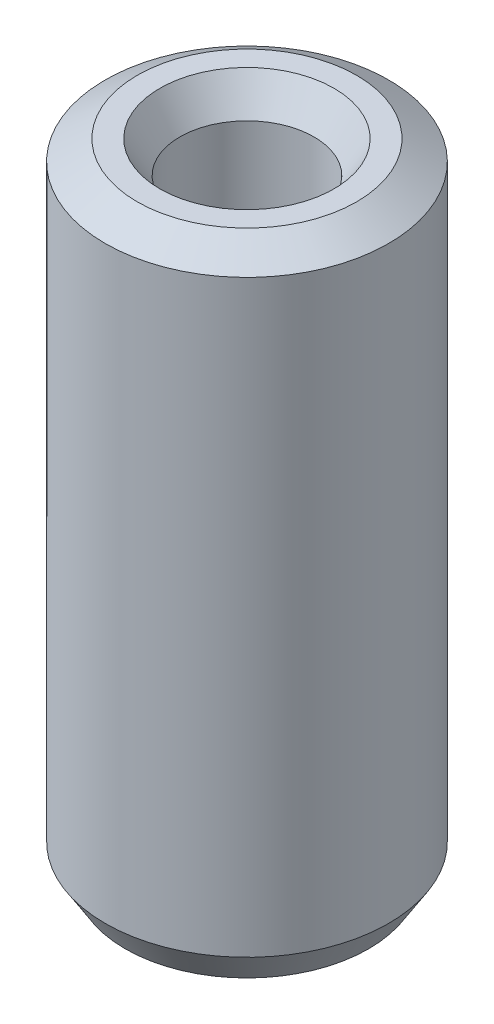
from build123d import *
from OCP.BRepFilletAPI import BRepFilletAPI_MakeChamfer

# Parameters (mm, degrees)
SKETCH1_R           = 7.5
BOSS_EXTRUDE1_DEPTH = 33.91997437
SKETCH2_R           = 3.550635287
CUT_EXTRUDE1_DEPTH  = 36.539621006
CHAMFER1_SIZE       = 1.060232976
CHAMFER1_SIZE2      = 1.696569266


with BuildPart() as part:
    # Sketch1 → Boss-Extrude1 (new body)
    with BuildSketch(Plane(origin=(0, 0, 0), x_dir=(1, 0, 0), z_dir=(0, 1, 0))):
        Circle(SKETCH1_R)
    extrude(amount=BOSS_EXTRUDE1_DEPTH)

    # Sketch2 → Cut-Extrude1 (cut, through all)
    with BuildSketch(Plane(origin=(0, 0, 0), x_dir=(1, 0, 0), z_dir=(0, 1, 0))):
        Circle(SKETCH2_R)
    extrude(amount=CUT_EXTRUDE1_DEPTH, mode=Mode.SUBTRACT)

    # Chamfer1: one chamfer whose edges measure the first distance from different faces: ONE call of the kernel's chamfer builder (chamfer() names one face for all edges)
    chamfer1_edges_1 = [part.edges().sort_by_distance(p)[0] for p in [
        (-3.550635287, 33.91997437, 0),
    ]]
    chamfer1_side_1 = [part.faces().sort_by_distance(p)[0] for p in [
        (-7.287867966, 33.91997437, 0),
    ]]
    chamfer1_edges_2 = [part.edges().sort_by_distance(p)[0] for p in [
        (-3.550635287, 0, 0),
    ]]
    chamfer1_side_2 = [part.faces().sort_by_distance(p)[0] for p in [
        (-3.550635287, 16.959987185, 0),
    ]]
    chamfer1_edges_3 = [part.edges().sort_by_distance(p)[0] for p in [
        (-7.5, 0, 0),
    ]]
    chamfer1_side_3 = [part.faces().sort_by_distance(p)[0] for p in [
        (-7.287867966, 0, 0),
    ]]
    chamfer1_edges_4 = [part.edges().sort_by_distance(p)[0] for p in [
        (-7.5, 33.91997437, 0),
    ]]
    chamfer1_side_4 = [part.faces().sort_by_distance(p)[0] for p in [
        (-7.5, 16.959987185, 0),
    ]]
    chamfer1 = BRepFilletAPI_MakeChamfer(part.part.solid().wrapped)
    for e in chamfer1_edges_1:
        chamfer1.Add(CHAMFER1_SIZE, CHAMFER1_SIZE2, e.wrapped, chamfer1_side_1[0].wrapped)  # the first distance lies on this face
    for e in chamfer1_edges_2:
        chamfer1.Add(CHAMFER1_SIZE, CHAMFER1_SIZE2, e.wrapped, chamfer1_side_2[0].wrapped)  # the first distance lies on this face
    for e in chamfer1_edges_3:
        chamfer1.Add(CHAMFER1_SIZE, CHAMFER1_SIZE2, e.wrapped, chamfer1_side_3[0].wrapped)  # the first distance lies on this face
    for e in chamfer1_edges_4:
        chamfer1.Add(CHAMFER1_SIZE, CHAMFER1_SIZE2, e.wrapped, chamfer1_side_4[0].wrapped)  # the first distance lies on this face
    add(Compound.cast(chamfer1.Shape()), mode=Mode.REPLACE)


solid = part.part
